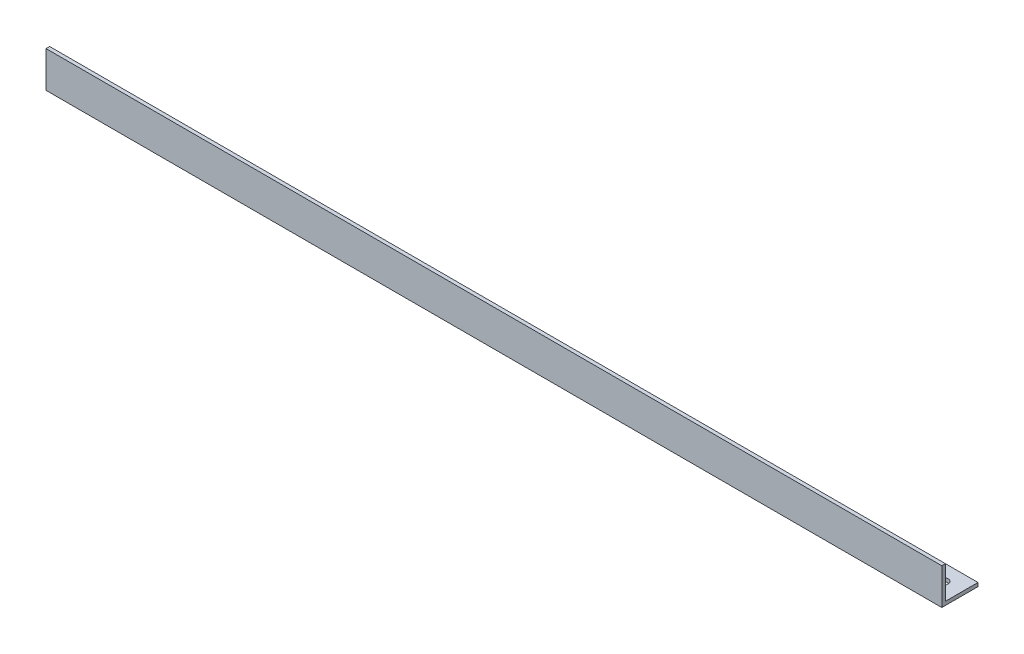
from build123d import *

# Parameters (mm, degrees)
BOSS_EXTRUDE1_DEPTH      = 325
BOSS_EXTRUDE1_DEPTH_BACK = 170
SKETCH2_R                = 2.95
SKETCH2_R_2              = 2.5
CUT_EXTRUDE1_DEPTH       = 2


with BuildPart() as part:
    # Sketch1 → Boss-Extrude1 (new, two sides: drawn at the far end of the back side and taken through both)
    with BuildSketch(Plane(origin=(0, 0, 0), x_dir=(0, 0, -1), z_dir=(1, 0, 0)).offset(-BOSS_EXTRUDE1_DEPTH_BACK)):
        Polygon((0, 20), (0, 0), (20, 0), (20, 2), (2, 2), (2, 20), align=None)
    extrude(amount=BOSS_EXTRUDE1_DEPTH + BOSS_EXTRUDE1_DEPTH_BACK)

    # Sketch2 → Cut-Extrude1 (cut)
    with BuildSketch(Plane(origin=(0, 2, 0), x_dir=(1, 0, 0), z_dir=(0, 1, 0))):
        with Locations((0, 9.8)):
            Circle(SKETCH2_R)
        with Locations((315, 11)):
            Circle(SKETCH2_R_2)
        with Locations((-160, 11)):
            Circle(SKETCH2_R_2)
    extrude(amount=-CUT_EXTRUDE1_DEPTH, mode=Mode.SUBTRACT)


solid = part.part
